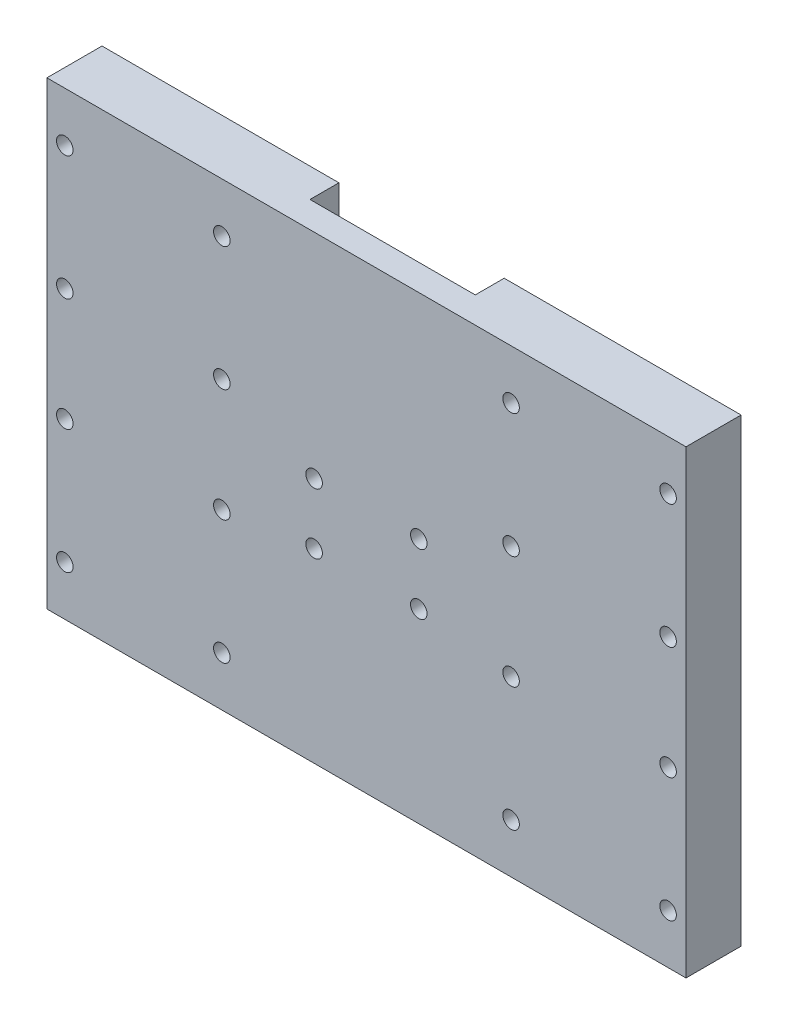
from build123d import *

# Parameters (mm, degrees)
SCHIZZO1_W                   = 232
SCHIZZO1_H                   = 167
ESTRUSIONE_ESTRUSIONE1_DEPTH = 20
SCHIZZO3_R                   = 3
TAGLIO_ESTRUSIONE1_DEPTH     = 145.31995704
SCHIZZO4_W                   = 60
SCHIZZO4_H                   = 10.5
TAGLIO_ESTRUSIONE2_DEPTH     = 205.315931831


with BuildPart() as part:
    # Schizzo1 → Estrusione-Estrusione1 (new body)
    with BuildSketch(Plane.XY):
        Rectangle(SCHIZZO1_W, SCHIZZO1_H)
    extrude(amount=ESTRUSIONE_ESTRUSIONE1_DEPTH)

    # Schizzo3 → Taglio-Estrusione1 (cut, through all)
    with BuildSketch(Plane.XY.offset(20)):
        with Locations((19, 6)):
            Circle(SCHIZZO3_R)
        with Locations((-19, 6)):
            Circle(SCHIZZO3_R)
        with Locations((-19, -16)):
            Circle(SCHIZZO3_R)
        with Locations((19, -16)):
            Circle(SCHIZZO3_R)
        with Locations((-109.5, 65.5)):
            Circle(SCHIZZO3_R)
        with Locations((-52.5, 65.5)):
            Circle(SCHIZZO3_R)
        with Locations((-109.5, 20.5)):
            Circle(SCHIZZO3_R)
        with Locations((-52.5, 20.5)):
            Circle(SCHIZZO3_R)
        with Locations((-109.5, -65.5)):
            Circle(SCHIZZO3_R)
        with Locations((-109.5, -20.5)):
            Circle(SCHIZZO3_R)
        with Locations((-52.5, -65.5)):
            Circle(SCHIZZO3_R)
        with Locations((-52.5, -20.5)):
            Circle(SCHIZZO3_R)
    taglio_estrusione1 = extrude(amount=-TAGLIO_ESTRUSIONE1_DEPTH, mode=Mode.SUBTRACT)

    # Schizzo4 → Taglio-Estrusione2 (cut, through all)
    with BuildSketch(Plane(origin=(0, 83.5, 0), x_dir=(1, 0, 0), z_dir=(0, 1, 0))):
        with Locations((0, -5.25)):
            Rectangle(SCHIZZO4_W, SCHIZZO4_H)
    extrude(amount=-TAGLIO_ESTRUSIONE2_DEPTH, mode=Mode.SUBTRACT)

    # Specchia1: Taglio-Estrusione1 across plane
    add(taglio_estrusione1.mirror(Plane(origin=(0, 0, 0), x_dir=(0, 0, 1), z_dir=(1, 0, 0))), mode=Mode.SUBTRACT)


solid = part.part
